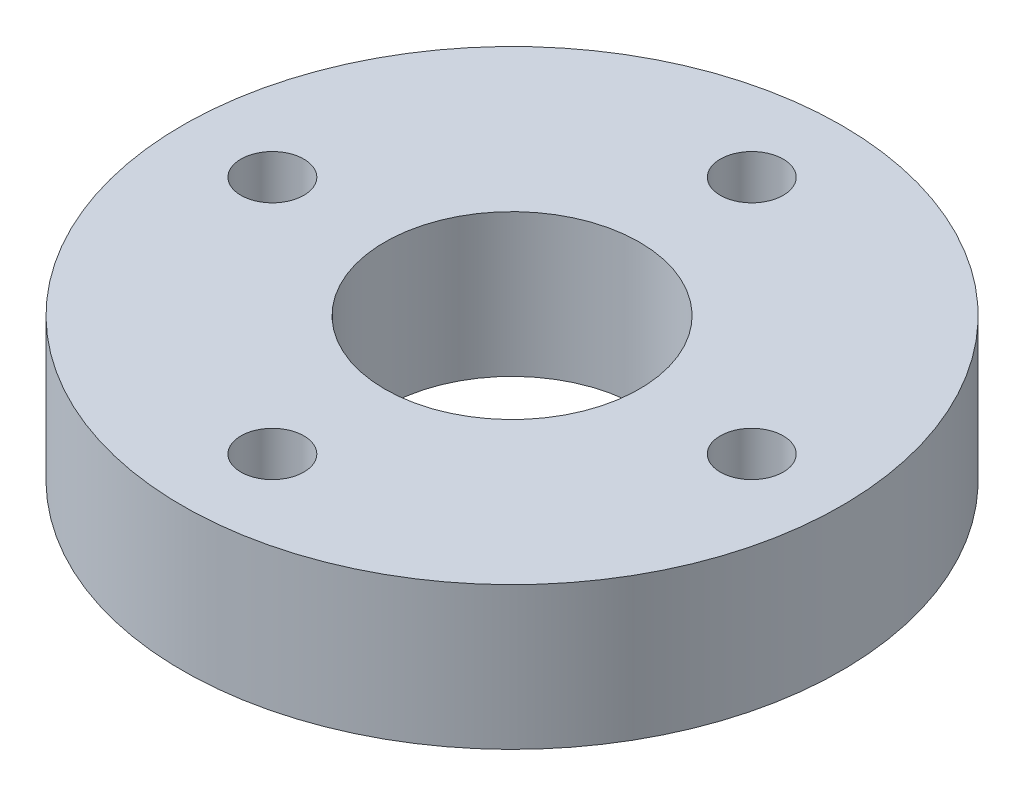
from build123d import *

# Parameters (mm, degrees)
SKETCH1_R           = 11
BOSS_EXTRUDE1_DEPTH = 4.7625
SKETCH2_R           = 1.05
CUT_EXTRUDE1_DEPTH  = 17.269032124
SKETCH3_R           = 4.25
CUT_EXTRUDE2_DEPTH  = 17.269032124


with BuildPart() as part:
    # Sketch1 → Boss-Extrude1 (new body)
    with BuildSketch(Plane(origin=(0, 0, 0), x_dir=(1, 0, 0), z_dir=(0, 1, 0))):
        Circle(SKETCH1_R)
    extrude(amount=BOSS_EXTRUDE1_DEPTH)

    # Sketch2 → Cut-Extrude1 (cut, through all)
    with BuildSketch(Plane(origin=(0, 4.7625, 0), x_dir=(-1, 0, 0), z_dir=(0, 1, 0))):
        with Locations((0, 8)):
            Circle(SKETCH2_R)
        with Locations((8, 0)):
            Circle(SKETCH2_R)
        with Locations((0, -8)):
            Circle(SKETCH2_R)
        with Locations((-8, 0)):
            Circle(SKETCH2_R)
    extrude(amount=-CUT_EXTRUDE1_DEPTH, mode=Mode.SUBTRACT)

    # Sketch3 → Cut-Extrude2 (cut, through all)
    with BuildSketch(Plane(origin=(0, 4.7625, 0), x_dir=(-1, 0, 0), z_dir=(0, 1, 0))):
        Circle(SKETCH3_R)
    extrude(amount=-CUT_EXTRUDE2_DEPTH, mode=Mode.SUBTRACT)


solid = part.part
